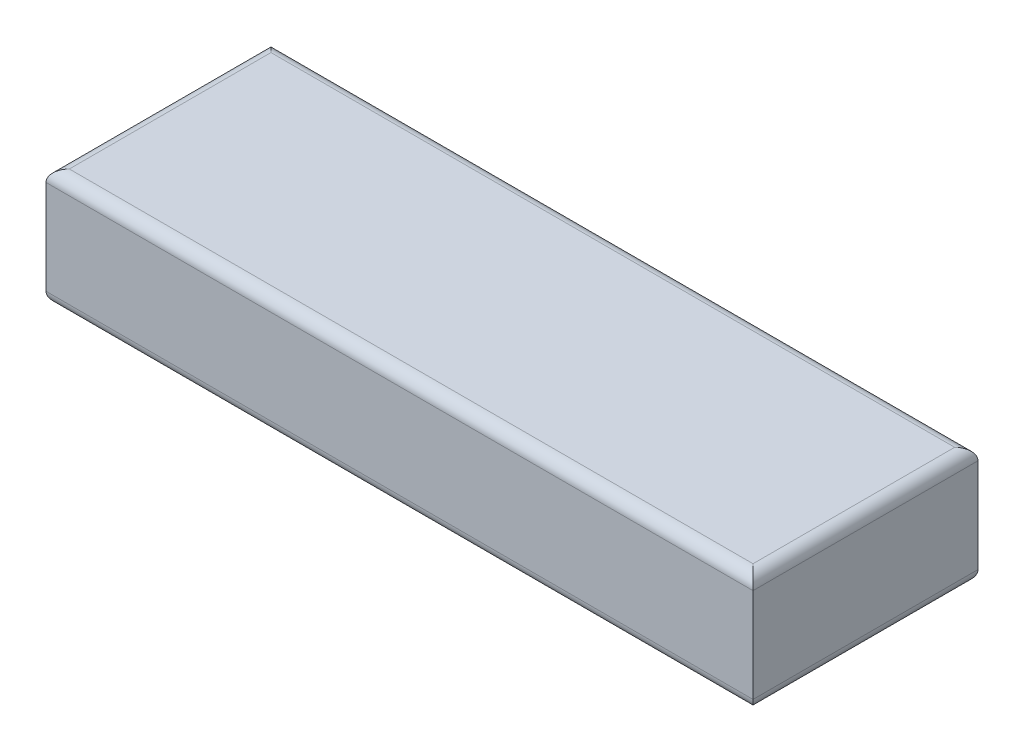
from build123d import *

# Parameters (mm, degrees)
SKETCH1_W           = 154
SKETCH1_H           = 49
BOSS_EXTRUDE1_DEPTH = 25.6
FILLET1_R           = 2.54


with BuildPart() as part:
    # Sketch1 → Boss-Extrude1 (new body)
    with BuildSketch(Plane(origin=(0, 0, 0), x_dir=(1, 0, 0), z_dir=(0, 1, 0))):
        with Locations((74.293650794, -27.914819758)):
            Rectangle(SKETCH1_W, SKETCH1_H)
    extrude(amount=BOSS_EXTRUDE1_DEPTH)

    # Fillet1
    fillet1_edges = [part.edges().sort_by_distance(p)[0] for p in [
        (74.293650794, 0, 3.414819758),
        (151.293650794, 0, 27.914819758),
        (74.293650794, 0, 52.414819758),
        (-2.706349206, 0, 27.914819758),
        (74.293650794, 25.6, 52.414819758),
        (151.293650794, 25.6, 27.914819758),
        (74.293650794, 25.6, 3.414819758),
        (-2.706349206, 25.6, 27.914819758),
    ]]
    fillet(fillet1_edges, radius=FILLET1_R)


solid = part.part
